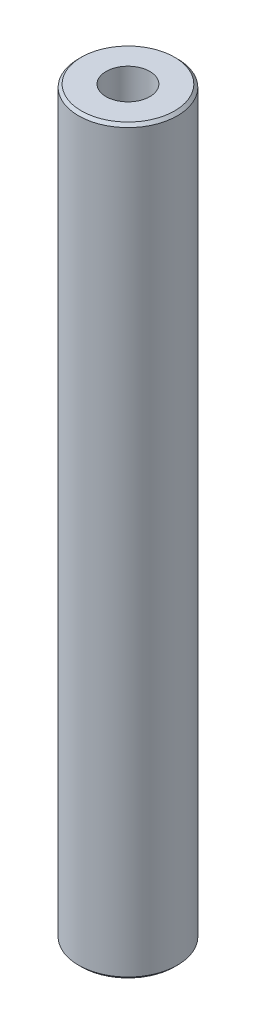
from build123d import *
from OCP.BRepFilletAPI import BRepFilletAPI_MakeChamfer

# Parameters (mm, degrees)
SKETCH1_R           = 40
BOSS_EXTRUDE1_DEPTH = 600
SKETCH2_R           = 17.713412093
CUT_EXTRUDE1_DEPTH  = 603.660766933
CHAMFER1_SIZE       = 2.274936444
CHAMFER1_SIZE2      = 2.287700145


with BuildPart() as part:
    # Sketch1 → Boss-Extrude1 (new body)
    with BuildSketch(Plane(origin=(0, 0, 0), x_dir=(1, 0, 0), z_dir=(0, 1, 0))):
        Circle(SKETCH1_R)
    extrude(amount=BOSS_EXTRUDE1_DEPTH)

    # Sketch2 → Cut-Extrude1 (cut, through all)
    with BuildSketch(Plane(origin=(0, 0, 0), x_dir=(1, 0, 0), z_dir=(0, 1, 0))):
        Circle(SKETCH2_R)
    extrude(amount=CUT_EXTRUDE1_DEPTH, mode=Mode.SUBTRACT)

    # Chamfer1: one chamfer whose edges measure the first distance from different faces: ONE call of the kernel's chamfer builder (chamfer() names one face for all edges)
    chamfer1_edges_1 = [part.edges().sort_by_distance(p)[0] for p in [
        (-40, 600, 0),
    ]]
    chamfer1_side_1 = [part.faces().sort_by_distance(p)[0] for p in [
        (-40, 300, 0),
    ]]
    chamfer1_edges_2 = [part.edges().sort_by_distance(p)[0] for p in [
        (-40, 0, 0),
    ]]
    chamfer1_side_2 = [part.faces().sort_by_distance(p)[0] for p in [
        (-38.86862915, 0, 0),
    ]]
    chamfer1 = BRepFilletAPI_MakeChamfer(part.part.solid().wrapped)
    for e in chamfer1_edges_1:
        chamfer1.Add(CHAMFER1_SIZE, CHAMFER1_SIZE2, e.wrapped, chamfer1_side_1[0].wrapped)  # the first distance lies on this face
    for e in chamfer1_edges_2:
        chamfer1.Add(CHAMFER1_SIZE, CHAMFER1_SIZE2, e.wrapped, chamfer1_side_2[0].wrapped)  # the first distance lies on this face
    add(Compound.cast(chamfer1.Shape()), mode=Mode.REPLACE)


solid = part.part
